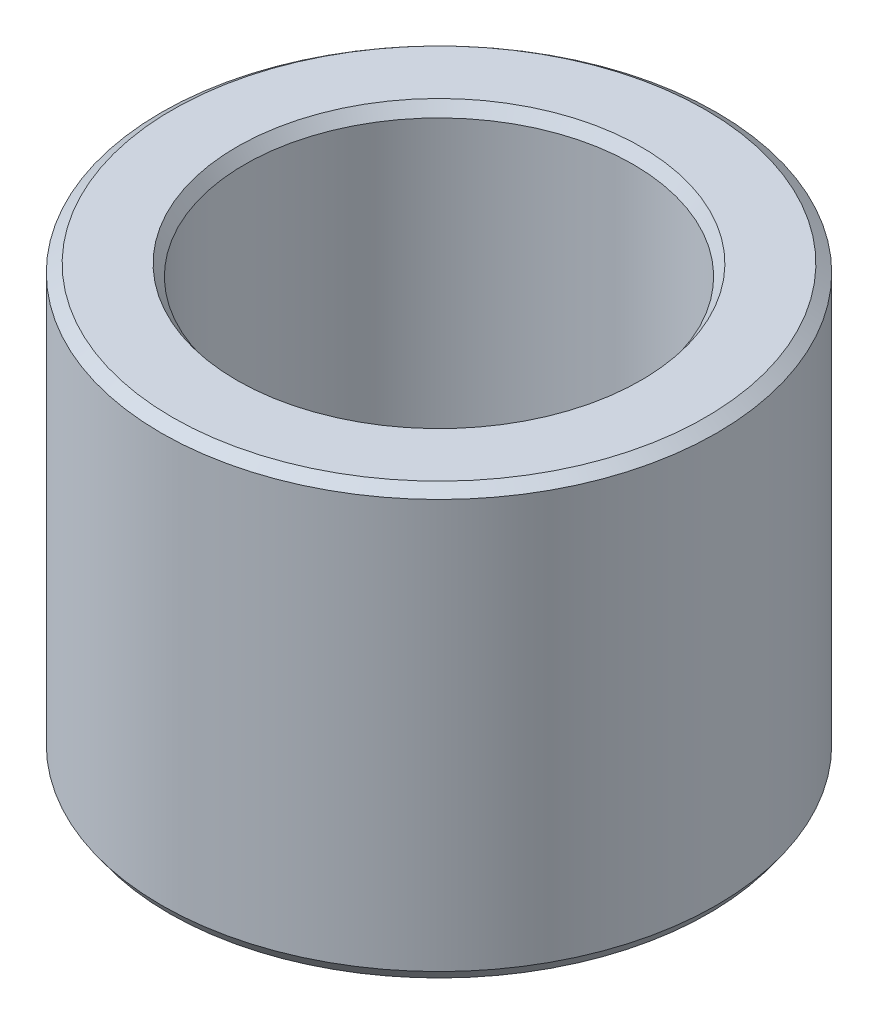
from build123d import *
from OCP.BRepFilletAPI import BRepFilletAPI_MakeChamfer

# Parameters (mm, degrees)
SKETCH1_R           = 45
BOSS_EXTRUDE1_DEPTH = 69.356438937
SKETCH2_R           = 31.470167458
CUT_EXTRUDE1_DEPTH  = 95.129249557
CHAMFER1_SIZE       = 1.29185178
CHAMFER1_SIZE2      = 1.815093146


with BuildPart() as part:
    # Sketch1 → Boss-Extrude1 (new body)
    with BuildSketch(Plane(origin=(0, 0, 0), x_dir=(1, 0, 0), z_dir=(0, 1, 0))):
        Circle(SKETCH1_R)
    extrude(amount=BOSS_EXTRUDE1_DEPTH)

    # Sketch2 → Cut-Extrude1 (cut, through all)
    with BuildSketch(Plane(origin=(0, 0, 0), x_dir=(1, 0, 0), z_dir=(0, 1, 0))):
        Circle(SKETCH2_R)
    extrude(amount=CUT_EXTRUDE1_DEPTH, mode=Mode.SUBTRACT)

    # Chamfer1: one chamfer whose edges measure the first distance from different faces: ONE call of the kernel's chamfer builder (chamfer() names one face for all edges)
    chamfer1_edges_1 = [part.edges().sort_by_distance(p)[0] for p in [
        (-31.470167458, 69.356438937, 0),
    ]]
    chamfer1_side_1 = [part.faces().sort_by_distance(p)[0] for p in [
        (-43.727207794, 69.356438937, 0),
    ]]
    chamfer1_edges_2 = [part.edges().sort_by_distance(p)[0] for p in [
        (-31.470167458, 0, 0),
    ]]
    chamfer1_side_2 = [part.faces().sort_by_distance(p)[0] for p in [
        (-31.470167458, 34.678219469, 0),
    ]]
    chamfer1_edges_3 = [part.edges().sort_by_distance(p)[0] for p in [
        (-45, 0, 0),
    ]]
    chamfer1_side_3 = [part.faces().sort_by_distance(p)[0] for p in [
        (-43.727207794, 0, 0),
    ]]
    chamfer1_edges_4 = [part.edges().sort_by_distance(p)[0] for p in [
        (-45, 69.356438937, 0),
    ]]
    chamfer1_side_4 = [part.faces().sort_by_distance(p)[0] for p in [
        (-45, 34.678219469, 0),
    ]]
    chamfer1 = BRepFilletAPI_MakeChamfer(part.part.solid().wrapped)
    for e in chamfer1_edges_1:
        chamfer1.Add(CHAMFER1_SIZE, CHAMFER1_SIZE2, e.wrapped, chamfer1_side_1[0].wrapped)  # the first distance lies on this face
    for e in chamfer1_edges_2:
        chamfer1.Add(CHAMFER1_SIZE, CHAMFER1_SIZE2, e.wrapped, chamfer1_side_2[0].wrapped)  # the first distance lies on this face
    for e in chamfer1_edges_3:
        chamfer1.Add(CHAMFER1_SIZE, CHAMFER1_SIZE2, e.wrapped, chamfer1_side_3[0].wrapped)  # the first distance lies on this face
    for e in chamfer1_edges_4:
        chamfer1.Add(CHAMFER1_SIZE, CHAMFER1_SIZE2, e.wrapped, chamfer1_side_4[0].wrapped)  # the first distance lies on this face
    add(Compound.cast(chamfer1.Shape()), mode=Mode.REPLACE)


solid = part.part
